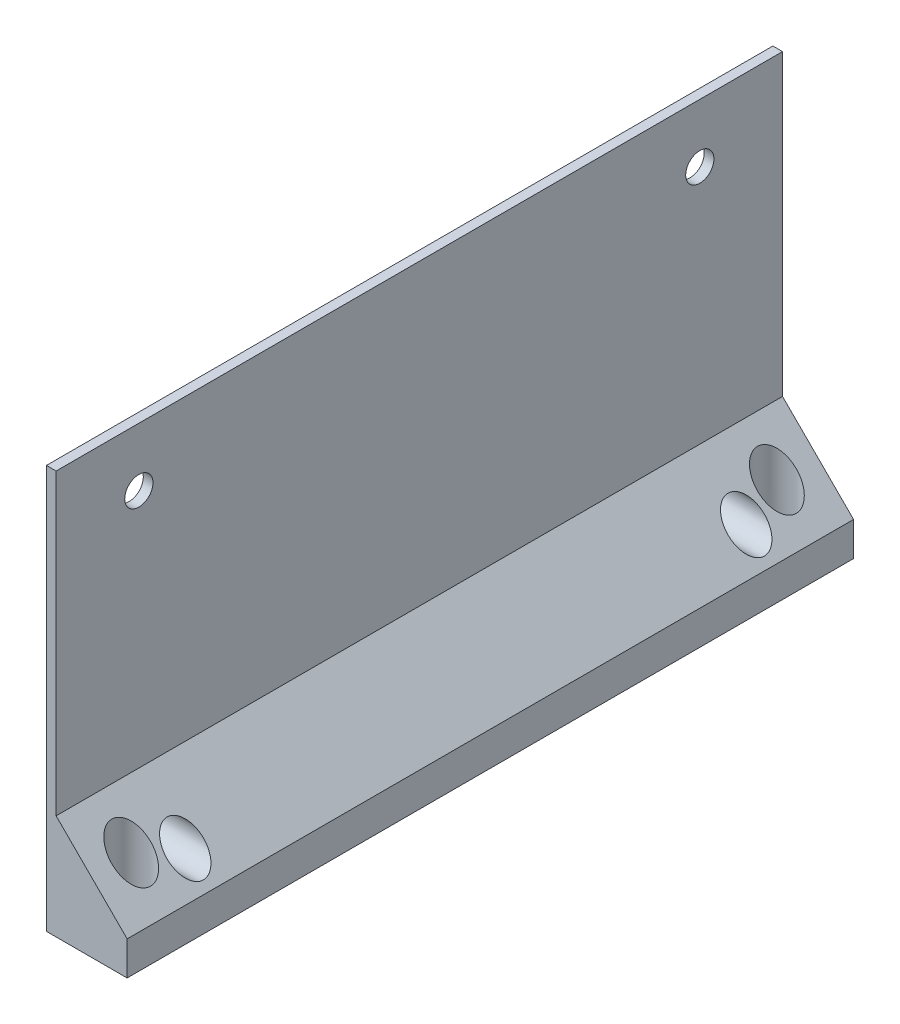
from build123d import *

# Parameters (mm, degrees)
BOSS_EXTRU_4_DEPTH      = 90
ESQUISSE8_R             = 1.75
ENL_V_MAT_EXTRU_5_DEPTH = 104.440804328
ESQUISSE9_R             = 2.4
ENL_V_MAT_EXTRU_6_DEPTH = 104.440804328
CONG_7_SIZE             = 10
ENL_V_START             = -1.2
ESQUISSE10_R            = 2.25
ESQUISSE10_R_2          = 1.75
ENL_V_MAT_EXTRU_7_DEPTH = 103.240804328


with BuildPart() as part:
    # Esquisse7 → Boss.-Extru.4 (new body)
    with BuildSketch(Plane.XY):
        Polygon((0, 0), (10, 0), (10, 3), (1.2, 3), (1.2, 50), (0, 50), align=None)
    extrude(amount=BOSS_EXTRU_4_DEPTH)

    # Esquisse8 → Enlèv. mat.-Extru.5 (cut, through all)
    with BuildSketch(Plane.ZY):
        with Locations((10.25, 42.75)):
            Circle(ESQUISSE8_R)
        with Locations((10.25, 7.25)):
            Circle(ESQUISSE8_R)
        with Locations((79.75, 7.25)):
            Circle(ESQUISSE8_R)
        with Locations((79.75, 42.75)):
            Circle(ESQUISSE8_R)
    extrude(amount=-ENL_V_MAT_EXTRU_5_DEPTH, mode=Mode.SUBTRACT)

    # Esquisse9 → Enlèv. mat.-Extru.6 (cut, through all)
    with BuildSketch(Plane.XZ):
        with Locations(Location((5.5, 85, 0), (0, 0, 270))):
            Circle(ESQUISSE9_R)
        with Locations(Location((5.5, 5, 0), (0, 0, 270))):
            Circle(ESQUISSE9_R)
    extrude(amount=-ENL_V_MAT_EXTRU_6_DEPTH, mode=Mode.SUBTRACT)

    # Congé7
    # the kernel refuses this chamfer: 10 mm, written as the material it adds along each edge
    with BuildSketch(Plane(origin=(1.2, 3, 0), x_dir=(0.9996219169112968, -0.02749587661058636, 0), z_dir=(0, 0, 1))) as cong_7_piece_1_section:
        Polygon((CONG_7_SIZE * 0.999621916911, CONG_7_SIZE * 0.0274958766106), (-CONG_7_SIZE * 0.0274958766106, CONG_7_SIZE * 0.999621916911), (0, 0), align=None)
    cong_7_piece_1 = extrude(amount=90, mode=Mode.PRIVATE)
    cong_7_piece_1 = split(cong_7_piece_1, bisect_by=Plane(origin=(10, 6.380086708, 44.999999953), z_dir=(-1, 0, 0)), keep=Keep.TOP, mode=Mode.PRIVATE)
    cong_7_piece_1 = cong_7_piece_1 - Plane(origin=(5.5, 6.380086708, 85), x_dir=(0, 0, -1), z_dir=(0, -1, 0)) * Cylinder(2.4, 220, mode=Mode.PRIVATE)
    cong_7_piece_1 = cong_7_piece_1 - Plane(origin=(5.5, 6.380086708, 5), x_dir=(0, 0, -1), z_dir=(0, -1, 0)) * Cylinder(2.4, 220, mode=Mode.PRIVATE)
    cong_7_piece_1 = cong_7_piece_1 - Plane(origin=(4.314878847, 7.25, 79.75), x_dir=(0, 0, 1), z_dir=(-1, 0, 0)) * Cylinder(1.75, 220, mode=Mode.PRIVATE)
    cong_7_piece_1 = cong_7_piece_1 - Plane(origin=(4.314878847, 7.25, 10.25), x_dir=(0, 0, 1), z_dir=(-1, 0, 0)) * Cylinder(1.75, 220, mode=Mode.PRIVATE)
    add(cong_7_piece_1)

    # Esquisse10 → Enlèv. mat.-Extru.7 (cut, through all)
    # profile 1 of 2: a face of its own
    with BuildSketch(Plane.ZY.offset(ENL_V_START)):
        with Locations((10.25, 7.25)):
            Circle(ESQUISSE10_R)
        with Locations((10.25, 7.25)):
            Circle(ESQUISSE10_R_2, mode=Mode.SUBTRACT)
    # profile 2 of 2: a face of its own
    with BuildSketch(Plane.ZY.offset(ENL_V_START)):
        with Locations((79.75, 7.25)):
            Circle(ESQUISSE10_R)
        with Locations((79.75, 7.25)):
            Circle(ESQUISSE10_R_2, mode=Mode.SUBTRACT)
    extrude(amount=-ENL_V_MAT_EXTRU_7_DEPTH, mode=Mode.SUBTRACT)


solid = part.part
